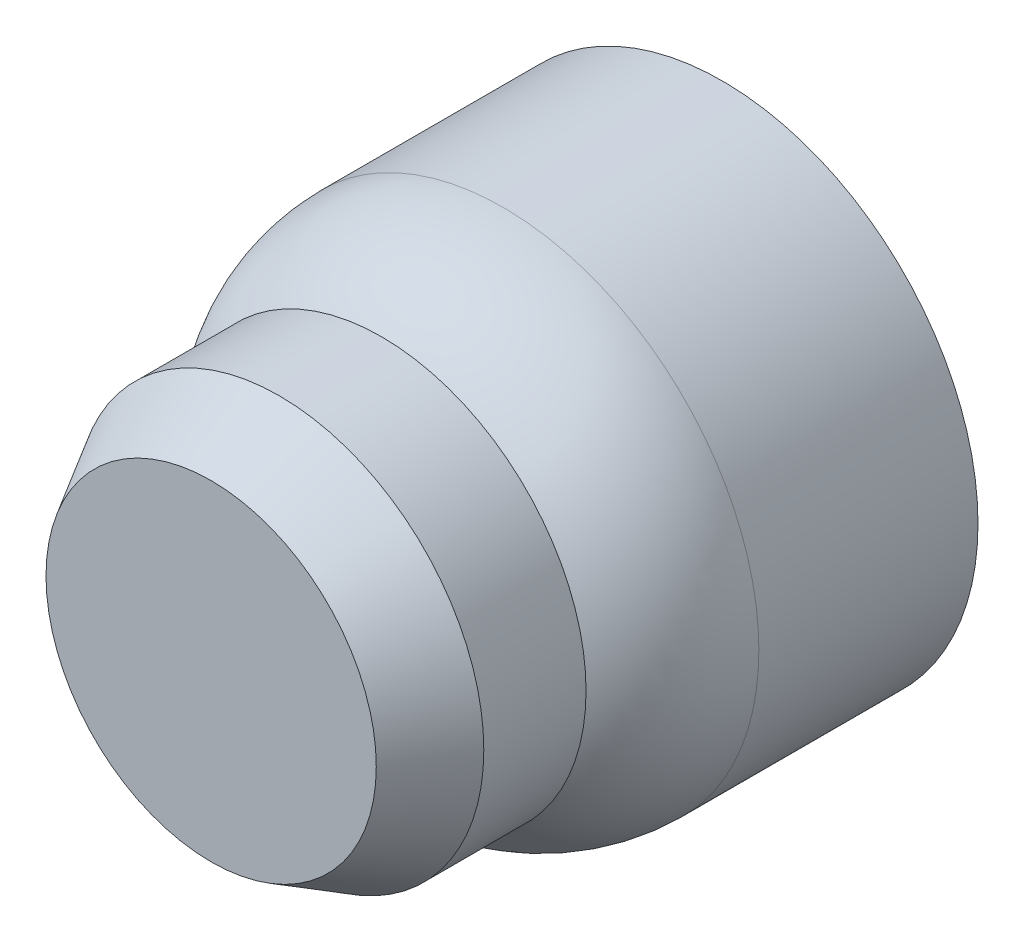
from build123d import *

# Parameters (mm, degrees)
SZKIC1_R                    = 6
DODANIE_WYCI_GNI_CIE1_DEPTH = 5
SZKIC2_R                    = 7.5
DODANIE_WYCI_GNI_CIE2_DEPTH = 10
SFAZOWANIE1_SIZE            = 2
SFAZOWANIE1_SIZE2           = 1.154700538
ZAOKR_GLENIE1_R             = 5


with BuildPart() as part:
    # Szkic1 → Dodanie-wyciągnięcie1 (new body)
    with BuildSketch(Plane.XY):
        Circle(SZKIC1_R)
    extrude(amount=DODANIE_WYCI_GNI_CIE1_DEPTH)

    # Szkic2 → Dodanie-wyciągnięcie2 (add)
    with BuildSketch(Plane.XY):
        Circle(SZKIC2_R)
    extrude(amount=-DODANIE_WYCI_GNI_CIE2_DEPTH)

    # Sfazowanie1
    sfazowanie1_edges = [part.edges().sort_by_distance(p)[0] for p in [
        (-6, 0, 5),
    ]]
    sfazowanie1_side = [part.faces().sort_by_distance(p)[0] for p in [
        (-6, 0, 2.5),
    ]]
    chamfer(sfazowanie1_edges, length=SFAZOWANIE1_SIZE, length2=SFAZOWANIE1_SIZE2, reference=sfazowanie1_side[0])

    # Zaokrąglenie1
    # the kernel refuses this fillet: 5 mm, written as the material it takes off along each edge
    with BuildSketch(Plane(origin=(0, 0, 0), x_dir=(1, 0, 0), z_dir=(0, -1, 0))) as zaokr_glenie1_piece_1:
        with BuildLine():
            CenterArc((2.5, -3.570714214), ZAOKR_GLENIE1_R, 0, 45.572995999)
            Line((7.5, -3.570714214), (7.6, -3.570714214))
            Line((7.6, -3.570714214), (7.6, 0))
            Line((7.6, 0), (7.5, 0.1))
            ThreePointArc((7.5, 0.1), (6.75, 0.1), (6.07, 0.071414284))
            Line((6.07, 0.071414284), (6, 0))
        make_face()
    revolve(axis=Axis((0, 0, 0), (0, 0, 1)), mode=Mode.SUBTRACT)


solid = part.part
